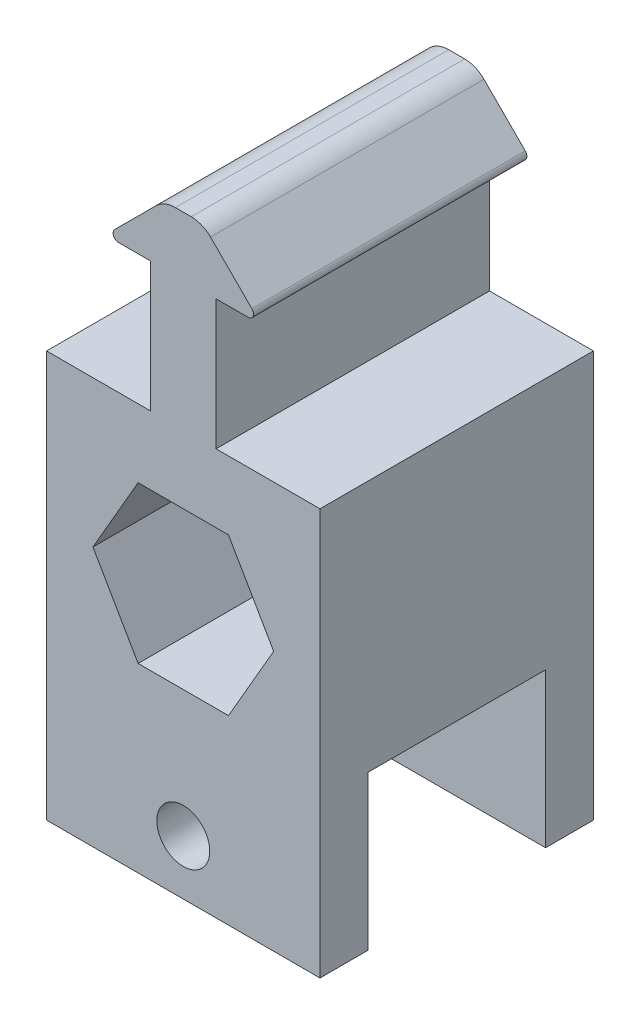
from build123d import *

# Parameters (mm, degrees)
BOSS_EXTRUDE1_DEPTH          = 12.7
SKETCH6_W                    = 16.51
SKETCH6_H                    = 14.31925
CUT_EXTRUDE2_DEPTH           = 43.141870353
F_10_0_1935_DIAMETER_HOLE1_D = 4.9149


with BuildPart() as part:
    # Sketch1 → Boss-Extrude1 (new, symmetric)
    with BuildSketch(Plane.XY):
        with BuildLine():
            Line((-12.7, 13.62075), (-12.7, -24.13))
            Line((-12.7, -24.13), (12.7, -24.13))
            Line((12.7, -24.13), (12.7, 13.62075))
            Line((12.7, 13.62075), (3.048, 13.62075))
            Line((3.048, 13.62075), (3.048, 25.68575))
            Line((3.048, 25.68575), (6.01257951, 25.68575))
            ThreePointArc((6.01257951, 25.68575), (6.481910313, 25.999346816), (6.371789755, 26.552960245))
            Line((6.371789755, 26.552960245), (2.532108776, 30.392641224))
            ThreePointArc((2.532108776, 30.392641224), (1.70807347, 30.943244013), (0.736057552, 31.13659))
            Line((0.736057552, 31.13659), (-0.736057552, 31.13659))
            ThreePointArc((-0.736057552, 31.13659), (-1.70807347, 30.943244013), (-2.532108776, 30.392641224))
            Line((-2.532108776, 30.392641224), (-6.371789755, 26.552960245))
            ThreePointArc((-6.371789755, 26.552960245), (-6.481910313, 25.999346816), (-6.01257951, 25.68575))
            Line((-6.01257951, 25.68575), (-3.048, 25.68575))
            Line((-3.048, 25.68575), (-3.048, 13.62075))
            Line((-3.048, 13.62075), (-12.7, 13.62075))
        make_face()
        Polygon((-4.19776947, 7.27075), (-8.395538939, 0), (-4.19776947, -7.27075), (4.19776947, -7.27075), (8.395538939, 0), (4.19776947, 7.27075), align=None, mode=Mode.SUBTRACT)
    extrude(amount=BOSS_EXTRUDE1_DEPTH, both=True)

    # Sketch6 → Cut-Extrude2 (cut, through all)
    with BuildSketch(Plane(origin=(12.7, 0, 0), x_dir=(0, 0, -1), z_dir=(1, 0, 0))):
        with Locations((0, -16.970375)):
            Rectangle(SKETCH6_W, SKETCH6_H)
    extrude(amount=-CUT_EXTRUDE2_DEPTH, mode=Mode.SUBTRACT)

    # #10 (0.1935) Diameter Hole1 (through all)
    with Locations(Plane.XY.offset(12.7)):
        with Locations((0, -19.05)):
            Hole(F_10_0_1935_DIAMETER_HOLE1_D / 2)


solid = part.part
